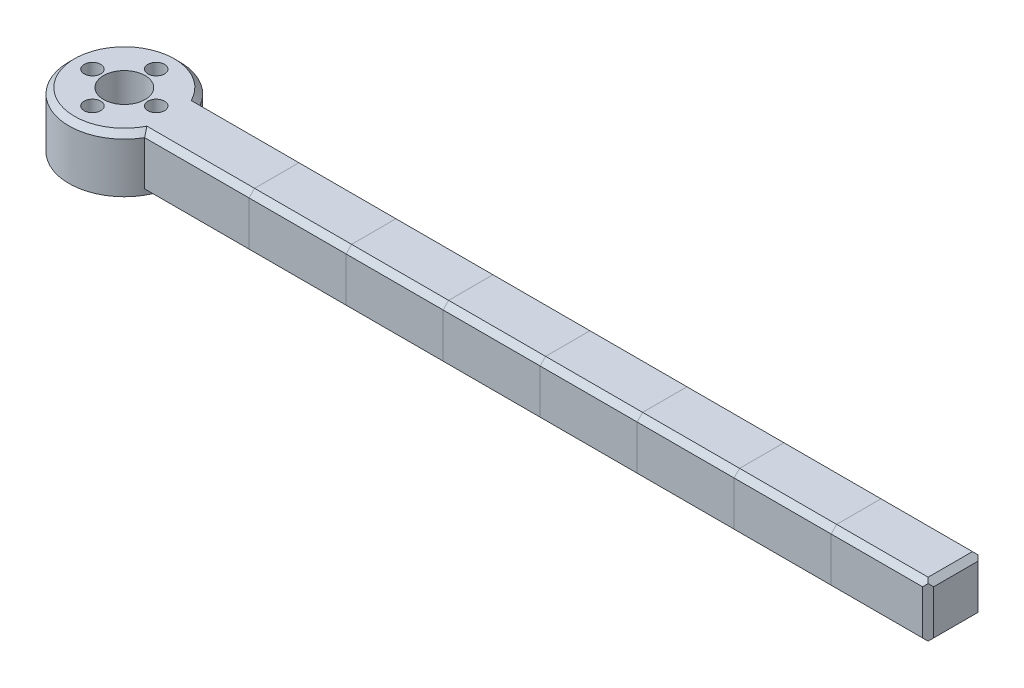
from build123d import *
from build123d.topology import SkipClean

# Parameters (mm, degrees)
SKETCH1_R           = 20
SKETCH1_R_2         = 7.5
SKETCH1_R_3         = 1.6
BOSS_EXTRUDE1_DEPTH = 20
SKETCH2_R           = 3
CUT_EXTRUDE2_DEPTH  = 18
BOSS_EXTRUDE2_START = -20
BOSS_EXTRUDE2_DEPTH = 20
SKETCH4_W           = 20
SKETCH4_H           = 20
BOSS_EXTRUDE3_DEPTH = 35
LPATTERN1_COUNT     = 7
LPATTERN1_PITCH     = 35
CHAMFER2_SIZE       = 2
CHAMFER3_SIZE       = 2
CHAMFER4_SIZE       = 2
CHAMFER5_SIZE       = 2
CHAMFER6_SIZE       = 2
CHAMFER7_SIZE       = 2
CHAMFER8_SIZE       = 2
CHAMFER9_SIZE       = 2
CHAMFER10_SIZE      = 2
CUT_EXTRUDE3_DEPTH  = 0.2
SKETCH6_W           = 3.2
SKETCH6_H           = 3.2
CUT_EXTRUDE4_DEPTH  = 0.2


with BuildPart() as part:
    # Sketch1 → Boss-Extrude1 (new body)
    with BuildSketch(Plane(origin=(0, 0, 0), x_dir=(1, 0, 0), z_dir=(0, 1, 0))):
        with Locations(Location((0, 0, 0), (0, 0, 270))):
            Circle(SKETCH1_R)
        with Locations(Location((0, 0, 0), (0, 0, 270))):
            Circle(SKETCH1_R_2, mode=Mode.SUBTRACT)
        with Locations(Location((0, 11.5, 0), (0, 0, 270))):
            Circle(SKETCH1_R_3, mode=Mode.SUBTRACT)
        with Locations(Location((11.5, 0, 0), (0, 0, 270))):
            Circle(SKETCH1_R_3, mode=Mode.SUBTRACT)
        with Locations(Location((0, -11.5, 0), (0, 0, 270))):
            Circle(SKETCH1_R_3, mode=Mode.SUBTRACT)
        with Locations(Location((-11.5, 0, 0), (0, 0, 270))):
            Circle(SKETCH1_R_3, mode=Mode.SUBTRACT)
    extrude(amount=BOSS_EXTRUDE1_DEPTH)

    # Sketch2 → Cut-Extrude2 (cut)
    with BuildSketch(Plane(origin=(0, 20, 0), x_dir=(1, 0, 0), z_dir=(0, 1, 0))):
        with Locations(Location((0, 11.5, 0), (0, 0, 270))):
            Circle(SKETCH2_R)
        with Locations(Location((11.5, 0, 0), (0, 0, 270))):
            Circle(SKETCH2_R)
        with Locations(Location((0, -11.5, 0), (0, 0, 270))):
            Circle(SKETCH2_R)
        with Locations(Location((-11.5, 0, 0), (0, 0, 270))):
            Circle(SKETCH2_R)
    extrude(amount=-CUT_EXTRUDE2_DEPTH, mode=Mode.SUBTRACT)

    # Sketch3 → Boss-Extrude2 (add)
    with BuildSketch(Plane(origin=(0, 20, 0), x_dir=(1, 0, 0), z_dir=(0, 1, 0)).offset(BOSS_EXTRUDE2_START)):
        with BuildLine():
            Line((55, -10), (55, 10))
            Line((55, 10), (17.320508076, 10))
            ThreePointArc((17.320508076, 10), (20, 0), (17.320508076, -10))
            Line((17.320508076, -10), (55, -10))
        make_face()
    extrude(amount=BOSS_EXTRUDE2_DEPTH)

    # Chamfer9
    chamfer9_edges = [part.edges().sort_by_distance(p)[0] for p in [
        (-20, 20, 0),
        (36.160254038, 20, -10),
        (36.160254038, 20, 10),
        (36.160254038, 0, -10),
        (36.160254038, 0, 10),
    ]]
    chamfer(chamfer9_edges, length=CHAMFER9_SIZE)

    # Sketch5 → Cut-Extrude3 (cut)
    with SkipClean():  # the faces are left unmerged after this step: merging them gives an invalid solid
        with BuildSketch(Plane(origin=(0, 2, 0), x_dir=(1, 0, 0), z_dir=(0, 1, 0))):
            with BuildLine():
                Line((-1.6, 8.962284492), (-1.6, 14.037715508))
                ThreePointArc((-1.6, 14.037715508), (0, 14.5), (1.6, 14.037715508))
                Line((1.6, 14.037715508), (1.6, 8.962284492))
                ThreePointArc((1.6, 8.962284492), (0, 8.5), (-1.6, 8.962284492))
            make_face()
            with BuildLine():
                Line((9.9, -2.537715508), (9.9, 2.537715508))
                ThreePointArc((9.9, 2.537715508), (11.5, 3), (13.1, 2.537715508))
                Line((13.1, 2.537715508), (13.1, -2.537715508))
                ThreePointArc((13.1, -2.537715508), (11.5, -3), (9.9, -2.537715508))
            make_face()
            with BuildLine():
                Line((-1.6, -14.037715508), (-1.6, -8.962284492))
                ThreePointArc((-1.6, -8.962284492), (0, -8.5), (1.6, -8.962284492))
                Line((1.6, -8.962284492), (1.6, -14.037715508))
                ThreePointArc((1.6, -14.037715508), (0, -14.5), (-1.6, -14.037715508))
            make_face()
            with BuildLine():
                Line((-13.1, -2.537715508), (-13.1, 2.537715508))
                ThreePointArc((-13.1, 2.537715508), (-11.5, 3), (-9.9, 2.537715508))
                Line((-9.9, 2.537715508), (-9.9, -2.537715508))
                ThreePointArc((-9.9, -2.537715508), (-11.5, -3), (-13.1, -2.537715508))
            make_face()
        extrude(amount=-CUT_EXTRUDE3_DEPTH, mode=Mode.SUBTRACT)

    # Sketch6 → Cut-Extrude4 (cut)
    with SkipClean():  # the faces are left unmerged after this step: merging them gives an invalid solid
        with BuildSketch(Plane(origin=(0, 1.8, 0), x_dir=(1, 0, 0), z_dir=(0, 1, 0))):
            with Locations((0, 11.5)):
                Rectangle(SKETCH6_W, SKETCH6_H)
            with Locations((11.5, 0)):
                Rectangle(SKETCH6_W, SKETCH6_H)
            with Locations((0, -11.5)):
                Rectangle(SKETCH6_W, SKETCH6_H)
            with Locations((-11.5, 0)):
                Rectangle(SKETCH6_W, SKETCH6_H)
        extrude(amount=-CUT_EXTRUDE4_DEPTH, mode=Mode.SUBTRACT)


with BuildPart() as body_2:
    # Sketch4 → Boss-Extrude3 (new body)
    with BuildSketch(Plane(origin=(55, 0, 0), x_dir=(0, 0, -1), z_dir=(1, 0, 0))):
        with Locations((0, 10)):
            Rectangle(SKETCH4_W, SKETCH4_H)
    boss_extrude3 = extrude(amount=BOSS_EXTRUDE3_DEPTH)

    # Chamfer2
    chamfer2_edges = [body_2.edges().sort_by_distance(p)[0] for p in [
        (72.5, 20, 10),
        (72.5, 20, -10),
        (72.5, 0, -10),
        (72.5, 0, 10),
    ]]
    chamfer(chamfer2_edges, length=CHAMFER2_SIZE)


with BuildPart() as lpattern1_1:
    # LPattern1: pattern copy
    add(boss_extrude3.moved(Location(Vector(1, 0, 0) * (1 * LPATTERN1_PITCH))))

    # Chamfer3
    chamfer3_edges = [lpattern1_1.edges().sort_by_distance(p)[0] for p in [
        (107.5, 20, 10),
        (107.5, 20, -10),
        (107.5, 0, -10),
        (107.5, 0, 10),
    ]]
    chamfer(chamfer3_edges, length=CHAMFER3_SIZE)


with BuildPart() as lpattern1_2:
    # LPattern1: pattern copy
    add(boss_extrude3.moved(Location(Vector(1, 0, 0) * (2 * LPATTERN1_PITCH))))

    # Chamfer4
    chamfer4_edges = [lpattern1_2.edges().sort_by_distance(p)[0] for p in [
        (142.5, 20, 10),
        (142.5, 20, -10),
        (142.5, 0, -10),
        (142.5, 0, 10),
    ]]
    chamfer(chamfer4_edges, length=CHAMFER4_SIZE)


with BuildPart() as lpattern1_3:
    # LPattern1: pattern copy
    add(boss_extrude3.moved(Location(Vector(1, 0, 0) * (3 * LPATTERN1_PITCH))))

    # Chamfer5
    chamfer5_edges = [lpattern1_3.edges().sort_by_distance(p)[0] for p in [
        (177.5, 20, 10),
        (177.5, 20, -10),
        (177.5, 0, -10),
        (177.5, 0, 10),
    ]]
    chamfer(chamfer5_edges, length=CHAMFER5_SIZE)


with BuildPart() as lpattern1_4:
    # LPattern1: pattern copy
    add(boss_extrude3.moved(Location(Vector(1, 0, 0) * (4 * LPATTERN1_PITCH))))

    # Chamfer6
    chamfer6_edges = [lpattern1_4.edges().sort_by_distance(p)[0] for p in [
        (212.5, 20, 10),
        (212.5, 20, -10),
        (212.5, 0, -10),
        (212.5, 0, 10),
    ]]
    chamfer(chamfer6_edges, length=CHAMFER6_SIZE)


with BuildPart() as lpattern1_5:
    # LPattern1: pattern copy
    add(boss_extrude3.moved(Location(Vector(1, 0, 0) * (5 * LPATTERN1_PITCH))))

    # Chamfer7
    chamfer7_edges = [lpattern1_5.edges().sort_by_distance(p)[0] for p in [
        (247.5, 20, 10),
        (247.5, 20, -10),
        (247.5, 0, -10),
        (247.5, 0, 10),
    ]]
    chamfer(chamfer7_edges, length=CHAMFER7_SIZE)


with BuildPart() as lpattern1_6:
    # LPattern1: pattern copy
    add(boss_extrude3.moved(Location(Vector(1, 0, 0) * (6 * LPATTERN1_PITCH))))

    # Chamfer8
    chamfer8_edges = [lpattern1_6.edges().sort_by_distance(p)[0] for p in [
        (282.5, 20, 10),
        (282.5, 20, -10),
        (282.5, 0, -10),
        (282.5, 0, 10),
    ]]
    chamfer(chamfer8_edges, length=CHAMFER8_SIZE)

    # Chamfer10
    # the kernel refuses this chamfer: 2 mm, written as the material it takes off along each edge
    with BuildSketch(Plane(origin=(300, 23.143365976, 10), x_dir=(0.02749587661058217, 0, -0.9996219169112968), z_dir=(0, -1, 0)), Plane(origin=(300, -3.143365976, -10), x_dir=(0.02749587661058217, 0, 0.9996219169112968), z_dir=(0, 1, 0)), Plane(origin=(300, 20, -13.143365976), x_dir=(0.0274958766105822, -0.999621916911297, 0), z_dir=(0, 0, 1))) as chamfer10_piece_1:
        Polygon((CHAMFER10_SIZE * 0.999621916911, -CHAMFER10_SIZE * 0.0274958766106), (-CHAMFER10_SIZE * 0.0274958766106, -CHAMFER10_SIZE * 0.999621916911), (0, 0), align=None)
    extrude(amount=26.286731952, mode=Mode.SUBTRACT)
    with BuildSketch(Plane(origin=(300, 0, 13.143365976), x_dir=(-0.9996219169112968, -0.027495876610586483, 0), z_dir=(0, 0, -1))) as chamfer10_piece_2:
        Polygon((CHAMFER10_SIZE * 0.999621916911, CHAMFER10_SIZE * 0.0274958766106), (-CHAMFER10_SIZE * 0.0274958766106, CHAMFER10_SIZE * 0.999621916911), (0, 0), align=None)
    extrude(amount=26.286731952, mode=Mode.SUBTRACT)


solid = Compound([part.part, body_2.part, lpattern1_1.part, lpattern1_2.part, lpattern1_3.part, lpattern1_4.part, lpattern1_5.part, lpattern1_6.part])
